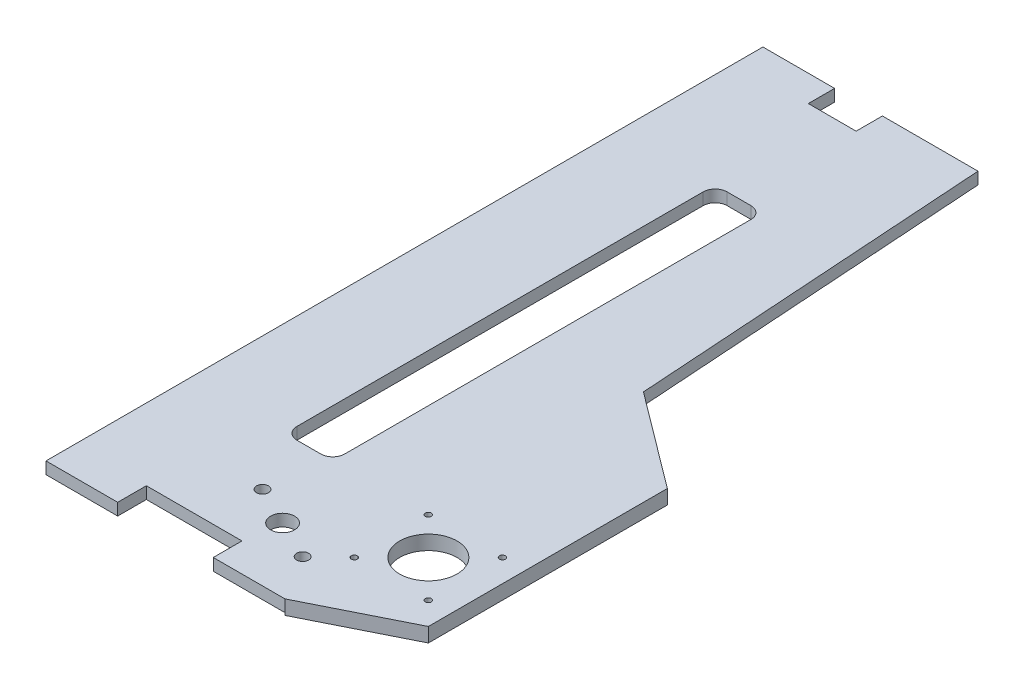
from build123d import *

# Parameters (mm, degrees)
BOSS_EXTRUDE1_DEPTH = 5
SKETCH2_R           = 5
SKETCH2_R_2         = 2.5
CUT_EXTRUDE1_DEPTH  = 6
SKETCH4_W           = 20
SKETCH4_H           = 11
CUT_EXTRUDE3_DEPTH  = 10
BOSS_EXTRUDE3_DEPTH = 6
SKETCH7_R           = 1.25
SKETCH7_R_2         = 12
CUT_EXTRUDE4_DEPTH  = 6
SKETCH9_W           = 20
SKETCH9_H           = 180
CUT_EXTRUDE5_DEPTH  = 6
FILLET1_R           = 5


with BuildPart() as part:
    # Sketch1 → Boss-Extrude1 (new body)
    with BuildSketch(Plane(origin=(0, 0, 0), x_dir=(1, 0, 0), z_dir=(0, 1, 0))):
        Polygon((0, 0), (30, 0), (30, 12), (70, 12), (70, 0), (100, 0), (100, 300), (0, 300), align=None)
    extrude(amount=BOSS_EXTRUDE1_DEPTH)

    # Sketch2 → Cut-Extrude1 (cut)
    with BuildSketch(Plane(origin=(0, 5, 0), x_dir=(1, 0, 0), z_dir=(0, 1, 0))):
        with Locations((72, 27)):
            Circle(SKETCH2_R)
        with Locations((88.403124702, 19)):
            Circle(SKETCH2_R_2)
        with Locations((55.596875298, 35)):
            Circle(SKETCH2_R_2)
    extrude(amount=-CUT_EXTRUDE1_DEPTH, mode=Mode.SUBTRACT)

    # Sketch4 → Cut-Extrude3 (cut)
    with BuildSketch(Plane(origin=(0, 5, 0), x_dir=(1, 0, 0), z_dir=(0, 1, 0))):
        with Locations((40, 294.5)):
            Rectangle(SKETCH4_W, SKETCH4_H)
    extrude(amount=-CUT_EXTRUDE3_DEPTH, mode=Mode.SUBTRACT)

    # Sketch6 → Boss-Extrude3 (add)
    with BuildSketch(Plane(origin=(0, 5, 0), x_dir=(1, 0, 0), z_dir=(0, 1, 0))):
        Polygon((100, 0), (100, 150), (140, 120), (140, 20), align=None)
    extrude(amount=-BOSS_EXTRUDE3_DEPTH)

    # Sketch7 → Cut-Extrude4 (cut)
    with BuildSketch(Plane(origin=(0, 5, 0), x_dir=(1, 0, 0), z_dir=(0, 1, 0))):
        with Locations((130.5, 60.5)):
            Circle(SKETCH7_R)
        with Locations((99.5, 60.5)):
            Circle(SKETCH7_R)
        with Locations((99.5, 29.5)):
            Circle(SKETCH7_R)
        with Locations((130.5, 29.5)):
            Circle(SKETCH7_R)
        with Locations((115, 45)):
            Circle(SKETCH7_R_2)
    extrude(amount=-CUT_EXTRUDE4_DEPTH, mode=Mode.SUBTRACT)

    # Sketch9 → Cut-Extrude5 (cut)
    with BuildSketch(Plane(origin=(0, 5, 0), x_dir=(1, 0, 0), z_dir=(0, 1, 0))):
        Polygon((100, 300), (90, 300), (100, 150), align=None)
        with Locations((50, 150)):
            Rectangle(SKETCH9_W, SKETCH9_H)
    extrude(amount=-CUT_EXTRUDE5_DEPTH, mode=Mode.SUBTRACT)

    # Fillet1
    fillet1_edges = [part.edges().sort_by_distance(p)[0] for p in [
        (40, 2.5, -240),
        (60, 2.5, -240),
        (60, 2.5, -60),
        (40, 2.5, -60),
    ]]
    fillet(fillet1_edges, radius=FILLET1_R)


solid = part.part
